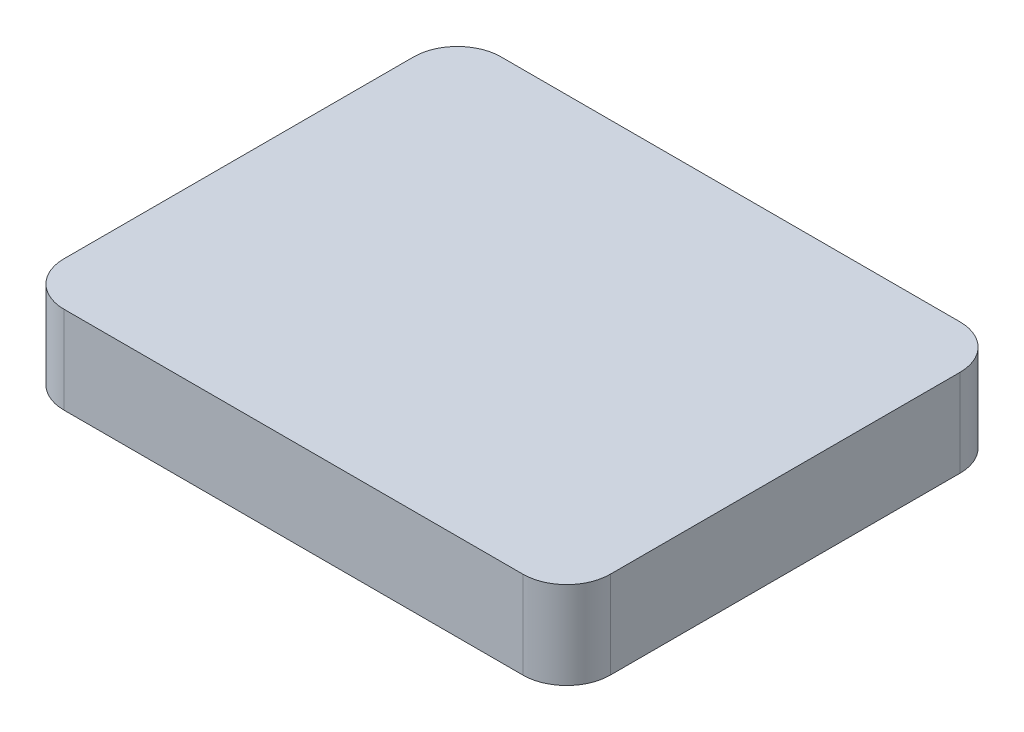
from build123d import *

# Parameters (mm, degrees)
SKETCH1_W           = 250
SKETCH1_H           = 200
BOSS_EXTRUDE1_DEPTH = 40
FILLET1_R           = 20


with BuildPart() as part:
    # Sketch1 → Boss-Extrude1 (new body)
    with BuildSketch(Plane(origin=(0, 0, 0), x_dir=(1, 0, 0), z_dir=(0, 1, 0))):
        Rectangle(SKETCH1_W, SKETCH1_H)
    extrude(amount=BOSS_EXTRUDE1_DEPTH)

    # Fillet1
    fillet1_edges = [part.edges().sort_by_distance(p)[0] for p in [
        (-125, 20, 100),
        (-125, 20, -100),
        (125, 20, -100),
        (125, 20, 100),
    ]]
    fillet(fillet1_edges, radius=FILLET1_R)


solid = part.part
